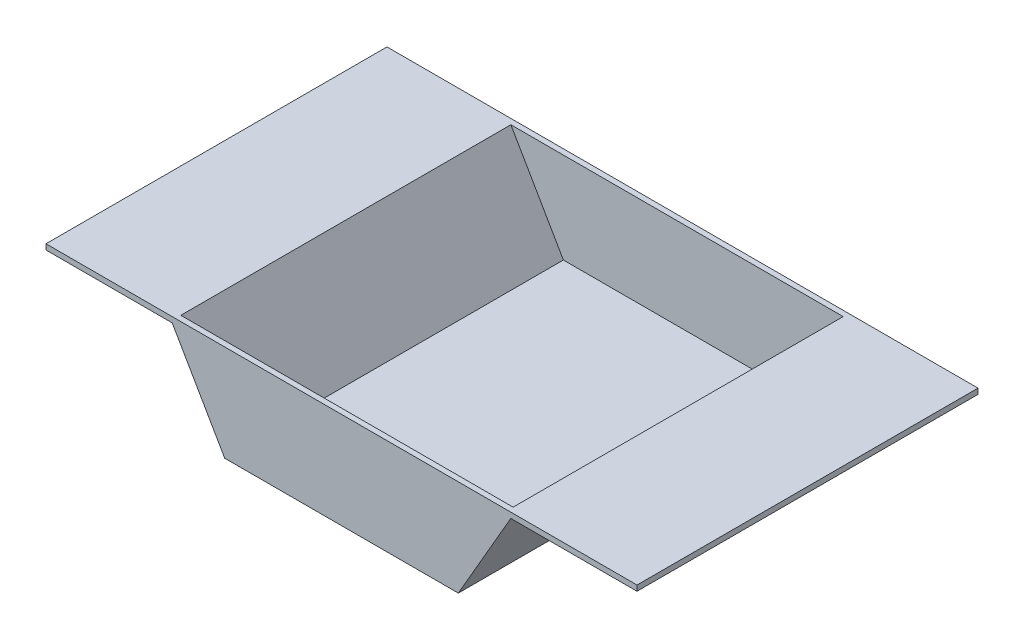
from build123d import *

# Parameters (mm, degrees)
BOSS_EXTRUDE2_DEPTH = 381
SHELL1_START        = 6.096
SHELL1_DEPTH        = 368.808


# Read off the part's stored shape, not the designer's step: Shell1
with BuildPart() as part:
    # Sketch2 → Boss-Extrude2 (new body)
    with BuildSketch(Plane.XY):
        Polygon((-330.2, 101.6), (-185.65878735, 101.6), (185.65878735, 101.6), (330.2, 101.6), (330.2, 95.504), (189.178314591, 95.504), (130.519527241, -6.096), (-130.519527241, -6.096), (-189.178314591, 95.504), (-330.2, 95.504), align=None)
    extrude(amount=BOSS_EXTRUDE2_DEPTH)

    # Shell1 outline → Shell1 (cut)
    with BuildSketch(Plane.XY.offset(SHELL1_START)):
        Polygon((-185.65878735, 101.6), (-127, 0), (127, 0), (185.65878735, 101.6), align=None)
    extrude(amount=SHELL1_DEPTH, mode=Mode.SUBTRACT)


solid = part.part
